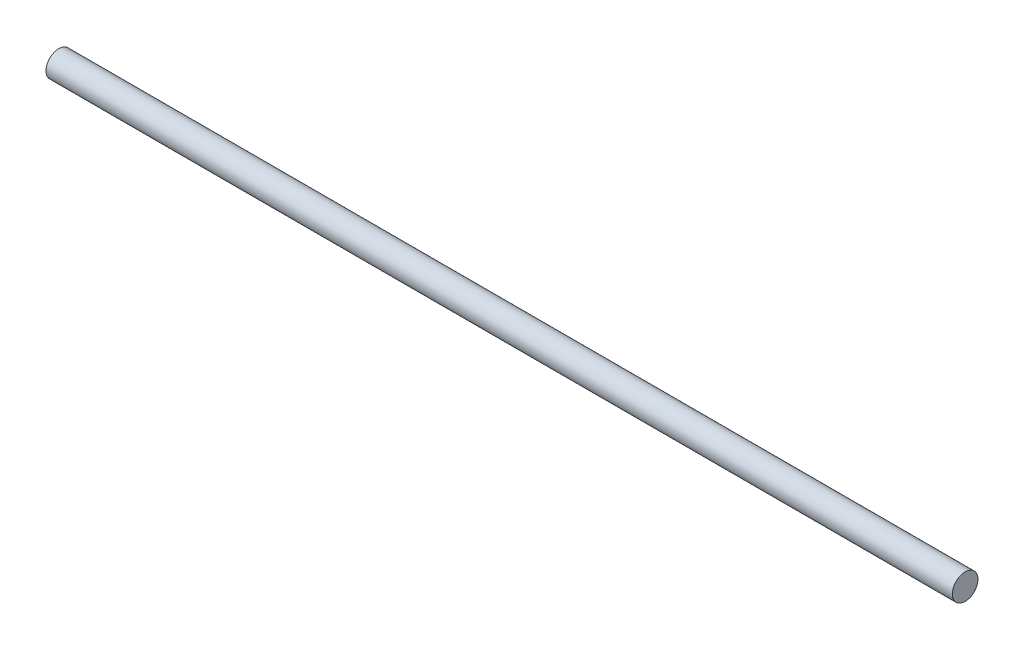
from build123d import *

# Parameters (mm, degrees)
SKETCH2_R           = 1.5
BOSS_EXTRUDE1_DEPTH = 106


with BuildPart() as part:
    # Sketch2 → Boss-Extrude1 (new body)
    with BuildSketch(Plane(origin=(0, 0, 0), x_dir=(0, 0, -1), z_dir=(1, 0, 0))):
        Circle(SKETCH2_R)
    extrude(amount=BOSS_EXTRUDE1_DEPTH)


solid = part.part
